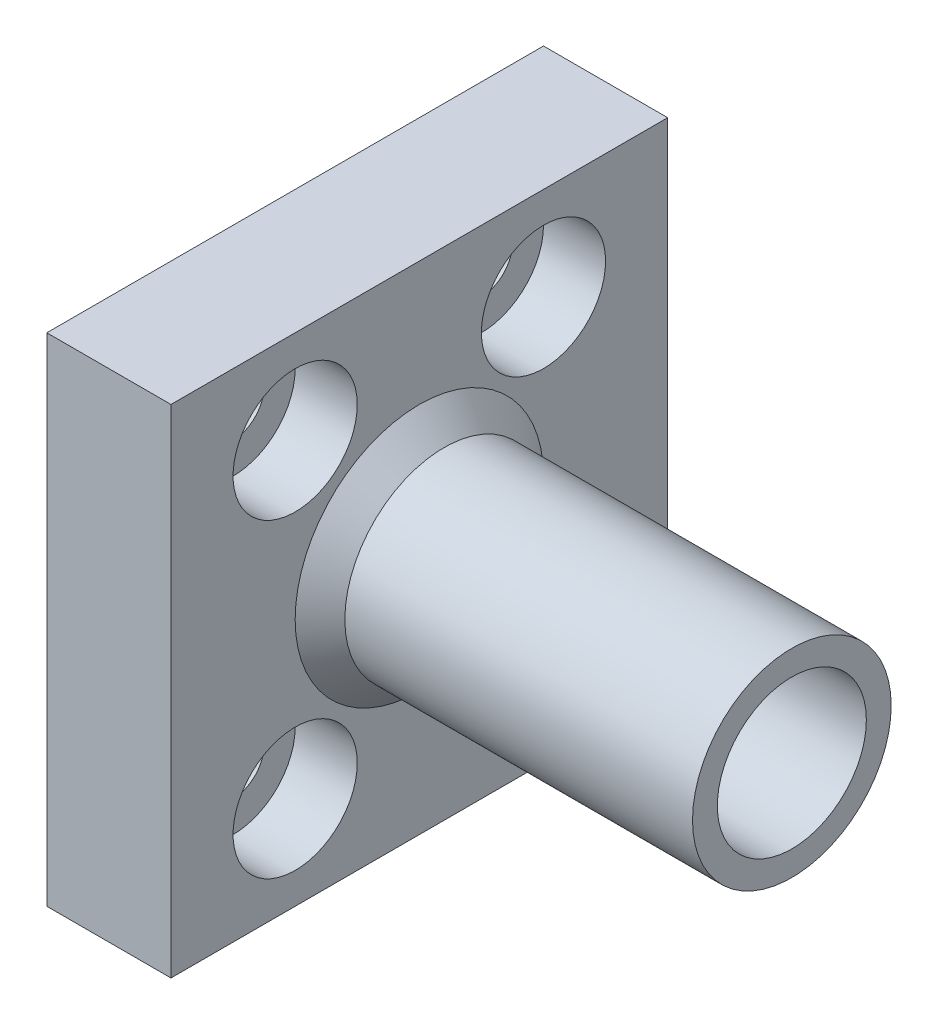
from build123d import *

# Parameters (mm, degrees)
SKETCH1_W           = 40
SKETCH1_H           = 40
BOSS_EXTRUDE1_DEPTH = 10
SKETCH2_R           = 8
BOSS_EXTRUDE2_DEPTH = 30
SKETCH4_R           = 2.5
CUT_EXTRUDE1_DEPTH  = 42.231056256
SKETCH5_R           = 6
CUT_EXTRUDE2_DEPTH  = 34
SKETCH6_R           = 5
CUT_EXTRUDE3_DEPTH  = 5
SKETCH7_R           = 1
CUT_EXTRUDE4_DEPTH  = 45.226688775
SKETCH8_R           = 2.5
CUT_EXTRUDE5_DEPTH  = 3
CHAMFER1_SIZE       = 2


with BuildPart() as part:
    # Sketch1 → Boss-Extrude1 (new body)
    with BuildSketch(Plane(origin=(0, 0, 0), x_dir=(0, 0, -1), z_dir=(1, 0, 0))):
        Rectangle(SKETCH1_W, SKETCH1_H)
    extrude(amount=BOSS_EXTRUDE1_DEPTH)

    # Sketch2 → Boss-Extrude2 (add)
    with BuildSketch(Plane(origin=(10, 0, 0), x_dir=(0, 0, -1), z_dir=(1, 0, 0))):
        Circle(SKETCH2_R)
    extrude(amount=BOSS_EXTRUDE2_DEPTH)

    # Sketch4 → Cut-Extrude1 (cut, through all)
    with BuildSketch(Plane(origin=(10, 0, 0), x_dir=(0, 0, -1), z_dir=(1, 0, 0))):
        with Locations((-10, 12.5)):
            Circle(SKETCH4_R)
        with Locations((-10, -12.5)):
            Circle(SKETCH4_R)
        with Locations((10, 12.5)):
            Circle(SKETCH4_R)
        with Locations((10, -12.5)):
            Circle(SKETCH4_R)
    extrude(amount=-CUT_EXTRUDE1_DEPTH, mode=Mode.SUBTRACT)

    # Sketch5 → Cut-Extrude2 (cut)
    with BuildSketch(Plane(origin=(40, 0, 0), x_dir=(0, 0, -1), z_dir=(1, 0, 0))):
        Circle(SKETCH5_R)
    extrude(amount=-CUT_EXTRUDE2_DEPTH, mode=Mode.SUBTRACT)

    # Sketch6 → Cut-Extrude3 (cut)
    with BuildSketch(Plane(origin=(10, 0, 0), x_dir=(0, 0, -1), z_dir=(1, 0, 0))):
        with Locations((-10, 12.5)):
            Circle(SKETCH6_R)
        with Locations((10, 12.5)):
            Circle(SKETCH6_R)
        with Locations((10, -12.5)):
            Circle(SKETCH6_R)
        with Locations((-10, -12.5)):
            Circle(SKETCH6_R)
    extrude(amount=-CUT_EXTRUDE3_DEPTH, mode=Mode.SUBTRACT)

    # Sketch7 → Cut-Extrude4 (cut, through all)
    with BuildSketch(Plane(origin=(6, 0, 0), x_dir=(0, 0, -1), z_dir=(1, 0, 0))):
        Circle(SKETCH7_R)
    extrude(amount=-CUT_EXTRUDE4_DEPTH, mode=Mode.SUBTRACT)

    # Sketch8 → Cut-Extrude5 (cut)
    with BuildSketch(Plane.ZY):
        Circle(SKETCH8_R)
    extrude(amount=-CUT_EXTRUDE5_DEPTH, mode=Mode.SUBTRACT)

    # Chamfer1
    chamfer1_edges = [part.edges().sort_by_distance(p)[0] for p in [
        (10, 0, 8),
    ]]
    chamfer(chamfer1_edges, length=CHAMFER1_SIZE)


solid = part.part
